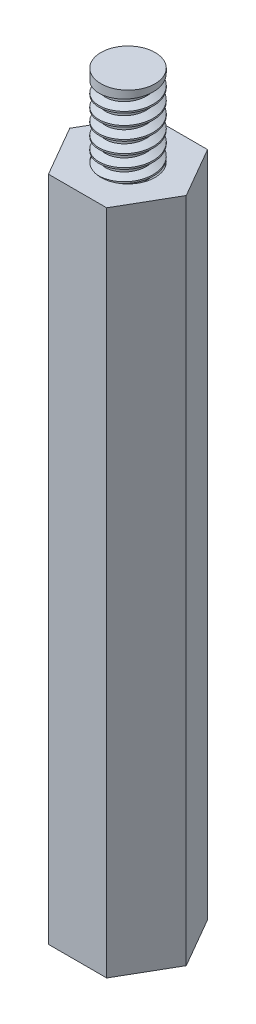
from build123d import *

# Parameters (mm, degrees)
SKETCH1_R                = 1
BOSS_EXTRUDE1_DEPTH      = 24.638
SKETCH1_3_R              = 1
CUT_EXTRUDE1_DEPTH       = 5
BOSS_EXTRUDE2_DEPTH      = 3
BOSS_EXTRUDE2_DEPTH_BACK = 1
SKETCH2_R                = 1
THREAD1_PITCH            = 0.45
THREAD2_PITCH            = 0.45


with BuildPart() as part:
    # Sketch1 → Boss-Extrude1 (new body)
    # profile 1 of 2: a face of its own
    with BuildSketch(Plane(origin=(0, 0, 0), x_dir=(1, 0, 0), z_dir=(0, 1, 0))):
        Polygon((-1.075752002, -1.863257123), (1.075752002, -1.863257123), (2.151504004, 0), (1.075752002, 1.863257123), (-1.075752002, 1.863257123), (-2.151504004, 0), align=None)
        Circle(SKETCH1_R, mode=Mode.SUBTRACT)
    # profile 2 of 2: a face of its own
    with BuildSketch(Plane(origin=(0, 0, 0), x_dir=(1, 0, 0), z_dir=(0, 1, 0))):
        Circle(SKETCH1_R)
    extrude(amount=BOSS_EXTRUDE1_DEPTH)

    # Sketch1<3> → Cut-Extrude1 (cut)
    with BuildSketch(Plane(origin=(0, 0, 0), x_dir=(1, 0, 0), z_dir=(0, 1, 0))):
        with Locations(Location((0, 0, 0), (0, 0, 270))):
            Circle(SKETCH1_3_R)
    extrude(amount=CUT_EXTRUDE1_DEPTH, mode=Mode.SUBTRACT)

    # Sketch2 → Boss-Extrude2 (add, two sides: drawn at the far end of the back side and taken through both)
    with BuildSketch(Plane(origin=(0, 24.638, 0), x_dir=(1, 0, 0), z_dir=(0, 1, 0)).offset(-BOSS_EXTRUDE2_DEPTH_BACK)):
        with Locations(Location((0, 0, 0), (0, 0, 270))):
            Circle(SKETCH2_R)
    extrude(amount=BOSS_EXTRUDE2_DEPTH + BOSS_EXTRUDE2_DEPTH_BACK)

    # Thread1: the profile of Thread Profile1 profile screwed along a right-hand helix of 6.666667 turns, 6 arcs to a turn; built about Z, then put on its axis
    thread1_z = Axis((0, 0, 0), (0, 0, 1))
    thread1_corners = [(1.0003, 0, -0.000173205), (1.0003, 0, 0.393923204), (0.756430356, 0, 0.253124999), (0.756430356, 0, 0.140624999)]
    with BuildLine(mode=Mode.PRIVATE) as thread1_profile:
        Line(thread1_corners[0], thread1_corners[1])
        Line(thread1_corners[1], thread1_corners[2])
        Line(thread1_corners[2], thread1_corners[3])
        Line(thread1_corners[3], thread1_corners[0])
    thread1_cap = Face(thread1_profile.wire())
    thread1_turn_angles = [0, 30, 60, 90, 120, 150, 180, 210, 240, 270, 300, 330, 360]
    thread1_turn_weights = [1, 0.8660254037844387, 1, 0.8660254037844387, 1, 0.8660254037844387, 1, 0.8660254037844387, 1, 0.8660254037844387, 1, 0.8660254037844387, 1]
    thread1_turn_rails = [Edge.make_bspline([Vector(p[0], p[1], 0).rotate(thread1_z, thread1_turn_angles[k]) / thread1_turn_weights[k] + Vector(0, 0, p[2] + THREAD1_PITCH * thread1_turn_angles[k] / 360) for k in range(13)], [0, 0, 0, 1, 1, 2, 2, 3, 3, 4, 4, 5, 5, 6, 6, 6], 2, thread1_turn_weights) for p in thread1_corners]
    thread1_turn_sides = [Face.make_surface_from_curves(thread1_turn_rails[p[0]], thread1_turn_rails[p[1]]) for p in [(0, 1), (1, 2), (2, 3), (3, 0)]]
    thread1_last_angles = [2160, 2190, 2220, 2250, 2280, 2310, 2340, 2370, 2400]
    thread1_last_weights = [1, 0.8660254037844387, 1, 0.8660254037844387, 1, 0.8660254037844387, 1, 0.8660254037844406, 1]
    thread1_last_rails = [Edge.make_bspline([Vector(p[0], p[1], 0).rotate(thread1_z, thread1_last_angles[k]) / thread1_last_weights[k] + Vector(0, 0, p[2] + THREAD1_PITCH * thread1_last_angles[k] / 360) for k in range(9)], [0, 0, 0, 1, 1, 2, 2, 3, 3, 4, 4, 4], 2, thread1_last_weights) for p in thread1_corners]
    thread1_last_sides = [Face.make_surface_from_curves(thread1_last_rails[p[0]], thread1_last_rails[p[1]]) for p in [(0, 1), (1, 2), (2, 3), (3, 0)]]
    thread1 = Plane(origin=(0, 27.638, 0), x_dir=(-1, 0, 0), z_dir=(0, -1, 0)) * Solid(Shell([*[p.moved(Location((0, 0, THREAD1_PITCH * i))) for i in range(6) for p in thread1_turn_sides], *thread1_last_sides, thread1_cap, thread1_cap.rotate(thread1_z, 2400).moved(Location((0, 0, THREAD1_PITCH * 2400 / 360)))]))
    add(thread1, mode=Mode.SUBTRACT)

    # Thread2: the profile of Thread Profile2 profile screwed along a right-hand helix of 4.444444 turns, 6 arcs to a turn; built about Z, then put on its axis
    thread2_z = Axis((0, 0, 0), (0, 0, 1))
    thread2_corners = [(1.0003, 0, -0.000173205), (1.0003, 0, 0.393923204), (0.756430356, 0, 0.253124999), (0.756430356, 0, 0.140624999)]
    with BuildLine(mode=Mode.PRIVATE) as thread2_profile:
        Line(thread2_corners[0], thread2_corners[1])
        Line(thread2_corners[1], thread2_corners[2])
        Line(thread2_corners[2], thread2_corners[3])
        Line(thread2_corners[3], thread2_corners[0])
    thread2_cap = Face(thread2_profile.wire())
    thread2_turn_angles = [0, 30, 60, 90, 120, 150, 180, 210, 240, 270, 300, 330, 360]
    thread2_turn_weights = [1, 0.8660254037844387, 1, 0.8660254037844387, 1, 0.8660254037844387, 1, 0.8660254037844387, 1, 0.8660254037844387, 1, 0.8660254037844387, 1]
    thread2_turn_rails = [Edge.make_bspline([Vector(p[0], p[1], 0).rotate(thread2_z, thread2_turn_angles[k]) / thread2_turn_weights[k] + Vector(0, 0, p[2] + THREAD2_PITCH * thread2_turn_angles[k] / 360) for k in range(13)], [0, 0, 0, 1, 1, 2, 2, 3, 3, 4, 4, 5, 5, 6, 6, 6], 2, thread2_turn_weights) for p in thread2_corners]
    thread2_turn_sides = [Face.make_surface_from_curves(thread2_turn_rails[p[0]], thread2_turn_rails[p[1]]) for p in [(0, 1), (1, 2), (2, 3), (3, 0)]]
    thread2_last_angles = [1440, 1470, 1500, 1530, 1560, 1580, 1600]
    thread2_last_weights = [1, 0.8660254037844387, 1, 0.8660254037844387, 1, 0.9396926207859078, 1]
    thread2_last_rails = [Edge.make_bspline([Vector(p[0], p[1], 0).rotate(thread2_z, thread2_last_angles[k]) / thread2_last_weights[k] + Vector(0, 0, p[2] + THREAD2_PITCH * thread2_last_angles[k] / 360) for k in range(7)], [0, 0, 0, 1, 1, 2, 2, 3, 3, 3], 2, thread2_last_weights) for p in thread2_corners]
    thread2_last_sides = [Face.make_surface_from_curves(thread2_last_rails[p[0]], thread2_last_rails[p[1]]) for p in [(0, 1), (1, 2), (2, 3), (3, 0)]]
    thread2 = Plane(origin=(0, 0, 0), x_dir=(1, 0, 0), z_dir=(0, 1, 0)) * Solid(Shell([*[p.moved(Location((0, 0, THREAD2_PITCH * i))) for i in range(4) for p in thread2_turn_sides], *thread2_last_sides, thread2_cap, thread2_cap.rotate(thread2_z, 1600).moved(Location((0, 0, THREAD2_PITCH * 1600 / 360)))]))
    add(thread2)


solid = part.part
